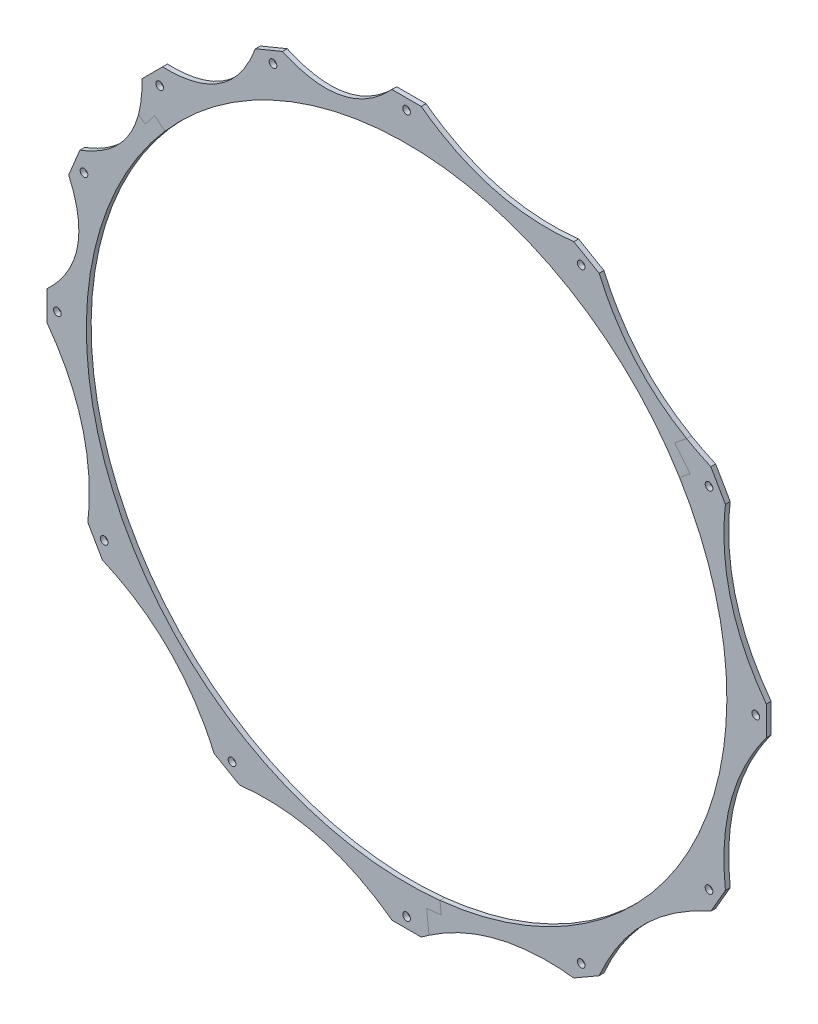
from build123d import *

# Parameters (mm, degrees)
SKETCH4_R           = 169.4688
SKETCH4_R_2         = 2.032
BOSS_EXTRUDE2_DEPTH = 2.54
SPLIT1_OUTLINE_R    = 2.032
SPLIT1_DEPTH        = 2.54
SPLIT1_2_OUTLINE_R  = 2.032
SPLIT1_2_DEPTH      = 2.54
SPLIT1_3_OUTLINE_R  = 2.032
SPLIT1_3_DEPTH      = 2.54


# Read off the part's stored shape, not the designer's step: Split1
with BuildPart() as part:
    # Sketch4 → Boss-Extrude2 (new body)
    with BuildSketch(Plane.XY):
        with BuildLine():
            Line((-7.735342369, 190.342886598), (7.735342369, 190.342886598))
            add(Edge.make_bspline(
                [(7.735342369, 190.342886598), (43.849986057, 163.650375876), (88.472440301, 168.709446408)],
                knots=[0, 0, 0, 1, 1, 1], degree=2))
            Line((88.472440301, 168.709446408), (101.870446297, 160.974104039))
            add(Edge.make_bspline(
                [(101.870446297, 160.974104039), (119.800389819, 119.800389819), (160.974104039, 101.870446297)],
                knots=[0, 0, 0, 1, 1, 1], degree=2))
            Line((160.974104039, 101.870446297), (168.709446408, 88.472440301))
            add(Edge.make_bspline(
                [(168.709446408, 88.472440301), (163.650375876, 43.849986057), (190.342886598, 7.735342369)],
                knots=[0, 0, 0, 1, 1, 1], degree=2))
            Line((190.342886598, 7.735342369), (190.342886598, -7.735342369))
            add(Edge.make_bspline(
                [(190.342886598, -7.735342369), (163.650375876, -43.849986057), (168.709446408, -88.472440301)],
                knots=[0, 0, 0, 1, 1, 1], degree=2))
            Line((168.709446408, -88.472440301), (160.974104039, -101.870446297))
            add(Edge.make_bspline(
                [(160.974104039, -101.870446297), (119.800389819, -119.800389819), (101.870446297, -160.974104039)],
                knots=[0, 0, 0, 1, 1, 1], degree=2))
            Line((101.870446297, -160.974104039), (88.472440301, -168.709446408))
            add(Edge.make_bspline(
                [(88.472440301, -168.709446408), (43.849986057, -163.650375876), (7.735342369, -190.342886598)],
                knots=[0, 0, 0, 1, 1, 1], degree=2))
            Line((7.735342369, -190.342886598), (-7.735342369, -190.342886598))
            add(Edge.make_bspline(
                [(-7.735342369, -190.342886598), (-43.849986057, -163.650375876), (-88.472440301, -168.709446408)],
                knots=[0, 0, 0, 1, 1, 1], degree=2))
            Line((-88.472440301, -168.709446408), (-101.870446297, -160.974104039))
            add(Edge.make_bspline(
                [(-101.870446297, -160.974104039), (-119.800389819, -119.800389819), (-160.974104039, -101.870446297)],
                knots=[0, 0, 0, 1, 1, 1], degree=2))
            Line((-160.974104039, -101.870446297), (-168.709446408, -88.472440301))
            add(Edge.make_bspline(
                [(-168.709446408, -88.472440301), (-163.650375876, -43.849986057), (-190.342886598, -7.735342369)],
                knots=[0, 0, 0, 1, 1, 1], degree=2))
            Line((-190.342886598, -7.735342369), (-190.342886598, 7.735342369))
            add(Edge.make_bspline(
                [(-190.342886598, 7.735342369), (-163.877360858, 32.597233808), (-178.814084455, 65.694544678)],
                knots=[0, 0, 0, 1, 1, 1], degree=2))
            Line((-178.814084455, 65.694544678), (-172.893709719, 79.987593661))
            add(Edge.make_bspline(
                [(-172.893709719, 79.987593661), (-138.92851822, 92.829068072), (-140.062458908, 129.12303282)],
                knots=[0, 0, 0, 1, 1, 1], degree=2))
            Line((-140.062458908, 129.12303282), (-129.12303282, 140.062458908))
            add(Edge.make_bspline(
                [(-129.12303282, 140.062458908), (-92.829068072, 138.92851822), (-79.987593661, 172.893709719)],
                knots=[0, 0, 0, 1, 1, 1], degree=2))
            Line((-79.987593661, 172.893709719), (-65.694544678, 178.814084455))
            add(Edge.make_bspline(
                [(-65.694544678, 178.814084455), (-32.597233808, 163.877360858), (-7.735342369, 190.342886598)],
                knots=[0, 0, 0, 1, 1, 1], degree=2))
        make_face()
        Circle(SKETCH4_R, mode=Mode.SUBTRACT)
        with Locations((0, 184.785)):
            Circle(SKETCH4_R_2, mode=Mode.SUBTRACT)
        with Locations((-160.028504238, -92.3925)):
            Circle(SKETCH4_R_2, mode=Mode.SUBTRACT)
        with Locations((-92.3925, -160.028504238)):
            Circle(SKETCH4_R_2, mode=Mode.SUBTRACT)
        with Locations((0, -184.785)):
            Circle(SKETCH4_R_2, mode=Mode.SUBTRACT)
        with Locations((92.3925, -160.028504238)):
            Circle(SKETCH4_R_2, mode=Mode.SUBTRACT)
        with Locations((160.028504238, -92.3925)):
            Circle(SKETCH4_R_2, mode=Mode.SUBTRACT)
        with Locations((184.785, 0)):
            Circle(SKETCH4_R_2, mode=Mode.SUBTRACT)
        with Locations((160.028504238, 92.3925)):
            Circle(SKETCH4_R_2, mode=Mode.SUBTRACT)
        with Locations((92.3925, 160.028504238)):
            Circle(SKETCH4_R_2, mode=Mode.SUBTRACT)
        with Locations((-70.71415805, 170.719079415)):
            Circle(SKETCH4_R_2, mode=Mode.SUBTRACT)
        with Locations((-130.662726562, 130.662726562)):
            Circle(SKETCH4_R_2, mode=Mode.SUBTRACT)
        with Locations((-170.719079415, 70.71415805)):
            Circle(SKETCH4_R_2, mode=Mode.SUBTRACT)
        with Locations((-184.785, 0)):
            Circle(SKETCH4_R_2, mode=Mode.SUBTRACT)
    extrude(amount=BOSS_EXTRUDE2_DEPTH)

    # Split1 2 outline → Split1 2 (cut)
    with BuildSketch(Plane.XY):
        with BuildLine():
            Line((-138.383085321, 109.142221195), (-133.291392081, 115.59805664))
            Line((-133.291392081, 115.59805664), (-127.815042264, 111.278880047))
            ThreePointArc((-127.815042264, 111.278880047), (150.363397658, 78.169833172), (17.658441351, -168.546295191))
            Line((17.658441351, -168.546295191), (18.327289217, -174.930314459))
            Line((18.327289217, -174.930314459), (10.611160262, -175.73872624))
            Line((10.611160262, -175.73872624), (11.836341153, -187.432833101))
            add(Edge.make_bspline(
                [(11.836341153, -187.432833101), (46.366816835, -163.935721553), (88.472440301, -168.709446408)],
                knots=[0.056402787, 0.056402787, 0.056402787, 1, 1, 1], degree=2))
            Line((88.472440301, -168.709446408), (101.870446297, -160.974104039))
            add(Edge.make_bspline(
                [(101.870446297, -160.974104039), (119.800389819, -119.800389819), (160.974104039, -101.870446297)],
                knots=[0, 0, 0, 1, 1, 1], degree=2))
            Line((160.974104039, -101.870446297), (168.709446408, -88.472440301))
            add(Edge.make_bspline(
                [(168.709446408, -88.472440301), (163.650375876, -43.849986057), (190.342886598, -7.735342369)],
                knots=[0, 0, 0, 1, 1, 1], degree=2))
            Line((190.342886598, -7.735342369), (190.342886598, 7.735342369))
            add(Edge.make_bspline(
                [(190.342886598, 7.735342369), (163.650375876, 43.849986057), (168.709446408, 88.472440301)],
                knots=[0, 0, 0, 1, 1, 1], degree=2))
            Line((168.709446408, 88.472440301), (160.974104039, 101.870446297))
            add(Edge.make_bspline(
                [(160.974104039, 101.870446297), (119.800389819, 119.800389819), (101.870446297, 160.974104039)],
                knots=[0, 0, 0, 1, 1, 1], degree=2))
            Line((101.870446297, 160.974104039), (88.472440301, 168.709446408))
            add(Edge.make_bspline(
                [(88.472440301, 168.709446408), (43.849986057, 163.650375876), (7.735342369, 190.342886598)],
                knots=[0, 0, 0, 1, 1, 1], degree=2))
            Line((7.735342369, 190.342886598), (-7.735342369, 190.342886598))
            add(Edge.make_bspline(
                [(-7.735342369, 190.342886598), (-32.597233808, 163.877360858), (-65.694544678, 178.814084455)],
                knots=[0, 0, 0, 1, 1, 1], degree=2))
            Line((-65.694544678, 178.814084455), (-79.987593661, 172.893709719))
            add(Edge.make_bspline(
                [(-79.987593661, 172.893709719), (-92.829068072, 138.92851822), (-129.12303282, 140.062458908)],
                knots=[0, 0, 0, 1, 1, 1], degree=2))
            Line((-129.12303282, 140.062458908), (-140.062458908, 129.12303282))
            add(Edge.make_bspline(
                [(-140.062458908, 129.12303282), (-139.768216299, 119.70522905), (-141.837317072, 111.866560842)],
                knots=[0, 0, 0, 0.259486772, 0.259486772, 0.259486772], degree=2))
            Line((-141.837317072, 111.866560842), (-138.383085321, 109.142221195))
        make_face()
        with Locations((92.3925, -160.028504238)):
            Circle(SPLIT1_2_OUTLINE_R, mode=Mode.SUBTRACT)
        with Locations((160.028504238, -92.3925)):
            Circle(SPLIT1_2_OUTLINE_R, mode=Mode.SUBTRACT)
        with Locations((184.785, 0)):
            Circle(SPLIT1_2_OUTLINE_R, mode=Mode.SUBTRACT)
        with Locations((-130.662726562, 130.662726562)):
            Circle(SPLIT1_2_OUTLINE_R, mode=Mode.SUBTRACT)
        with Locations((-70.71415805, 170.719079415)):
            Circle(SPLIT1_2_OUTLINE_R, mode=Mode.SUBTRACT)
        with Locations((0, 184.785)):
            Circle(SPLIT1_2_OUTLINE_R, mode=Mode.SUBTRACT)
        with Locations((160.028504238, 92.3925)):
            Circle(SPLIT1_2_OUTLINE_R, mode=Mode.SUBTRACT)
        with Locations((92.3925, 160.028504238)):
            Circle(SPLIT1_2_OUTLINE_R, mode=Mode.SUBTRACT)
    extrude(amount=SPLIT1_2_DEPTH, mode=Mode.SUBTRACT)


with BuildPart() as body_2:
    # Split1 outline → Split1 (new body)
    with BuildSketch(Plane.XY):
        with BuildLine():
            add(Edge.make_bspline(
                [(-140.062458908, 129.12303282), (-139.768216299, 119.70522905), (-141.837317072, 111.866560842)],
                knots=[0, 0, 0, 0.259486772, 0.259486772, 0.259486772], degree=2))
            Line((-141.837317072, 111.866560842), (-138.383085321, 109.142221195))
            Line((-138.383085321, 109.142221195), (-133.291392081, 115.59805664))
            Line((-133.291392081, 115.59805664), (-127.815042264, 111.278880047))
            ThreePointArc((-127.815042264, 111.278880047), (14.028916423, 168.887132954), (144.423733134, 88.664871742))
            Line((144.423733134, 88.664871742), (149.987836319, 93.169145748))
            Line((149.987836319, 93.169145748), (141.852248686, 103.218989295))
            Line((141.852248686, 103.218989295), (148.169462586, 108.332924357))
            add(Edge.make_bspline(
                [(148.169462586, 108.332924357), (116.877911093, 126.51147085), (101.870446297, 160.974104039)],
                knots=[0.162994307, 0.162994307, 0.162994307, 1, 1, 1], degree=2))
            Line((101.870446297, 160.974104039), (88.472440301, 168.709446408))
            add(Edge.make_bspline(
                [(88.472440301, 168.709446408), (43.849986057, 163.650375876), (7.735342369, 190.342886598)],
                knots=[0, 0, 0, 1, 1, 1], degree=2))
            Line((7.735342369, 190.342886598), (-7.735342369, 190.342886598))
            add(Edge.make_bspline(
                [(-7.735342369, 190.342886598), (-32.597233808, 163.877360858), (-65.694544678, 178.814084455)],
                knots=[0, 0, 0, 1, 1, 1], degree=2))
            Line((-65.694544678, 178.814084455), (-79.987593661, 172.893709719))
            add(Edge.make_bspline(
                [(-79.987593661, 172.893709719), (-92.829068072, 138.92851822), (-129.12303282, 140.062458908)],
                knots=[0, 0, 0, 1, 1, 1], degree=2))
            Line((-129.12303282, 140.062458908), (-140.062458908, 129.12303282))
        make_face()
        with Locations((-130.662726562, 130.662726562)):
            Circle(SPLIT1_OUTLINE_R, mode=Mode.SUBTRACT)
        with Locations((-70.71415805, 170.719079415)):
            Circle(SPLIT1_OUTLINE_R, mode=Mode.SUBTRACT)
        with Locations((0, 184.785)):
            Circle(SPLIT1_OUTLINE_R, mode=Mode.SUBTRACT)
        with Locations((92.3925, 160.028504238)):
            Circle(SPLIT1_OUTLINE_R, mode=Mode.SUBTRACT)
    extrude(amount=SPLIT1_DEPTH)


with BuildPart() as body_3:
    # Split1 3 outline → Split1 3 (new body)
    with BuildSketch(Plane.XY):
        with BuildLine():
            Line((148.169462586, 108.332924357), (141.852248686, 103.218989295))
            Line((141.852248686, 103.218989295), (149.987836319, 93.169145748))
            Line((149.987836319, 93.169145748), (144.423733134, 88.664871742))
            ThreePointArc((144.423733134, 88.664871742), (152.010045458, -74.917422895), (17.658441351, -168.546295191))
            Line((17.658441351, -168.546295191), (18.327289217, -174.930314459))
            Line((18.327289217, -174.930314459), (10.611160262, -175.73872624))
            Line((10.611160262, -175.73872624), (11.836341153, -187.432833101))
            add(Edge.make_bspline(
                [(11.836341153, -187.432833101), (46.366816835, -163.935721553), (88.472440301, -168.709446408)],
                knots=[0.056402787, 0.056402787, 0.056402787, 1, 1, 1], degree=2))
            Line((88.472440301, -168.709446408), (101.870446297, -160.974104039))
            add(Edge.make_bspline(
                [(101.870446297, -160.974104039), (119.800389819, -119.800389819), (160.974104039, -101.870446297)],
                knots=[0, 0, 0, 1, 1, 1], degree=2))
            Line((160.974104039, -101.870446297), (168.709446408, -88.472440301))
            add(Edge.make_bspline(
                [(168.709446408, -88.472440301), (163.650375876, -43.849986057), (190.342886598, -7.735342369)],
                knots=[0, 0, 0, 1, 1, 1], degree=2))
            Line((190.342886598, -7.735342369), (190.342886598, 7.735342369))
            add(Edge.make_bspline(
                [(190.342886598, 7.735342369), (163.650375876, 43.849986057), (168.709446408, 88.472440301)],
                knots=[0, 0, 0, 1, 1, 1], degree=2))
            Line((168.709446408, 88.472440301), (160.974104039, 101.870446297))
            add(Edge.make_bspline(
                [(160.974104039, 101.870446297), (154.263023008, 104.792925023), (148.169462586, 108.332924357)],
                knots=[0, 0, 0, 0.162994307, 0.162994307, 0.162994307], degree=2))
        make_face()
        with Locations((92.3925, -160.028504238)):
            Circle(SPLIT1_3_OUTLINE_R, mode=Mode.SUBTRACT)
        with Locations((160.028504238, -92.3925)):
            Circle(SPLIT1_3_OUTLINE_R, mode=Mode.SUBTRACT)
        with Locations((184.785, 0)):
            Circle(SPLIT1_3_OUTLINE_R, mode=Mode.SUBTRACT)
        with Locations((160.028504238, 92.3925)):
            Circle(SPLIT1_3_OUTLINE_R, mode=Mode.SUBTRACT)
    extrude(amount=SPLIT1_3_DEPTH)


solid = Compound([part.part, body_2.part, body_3.part])
